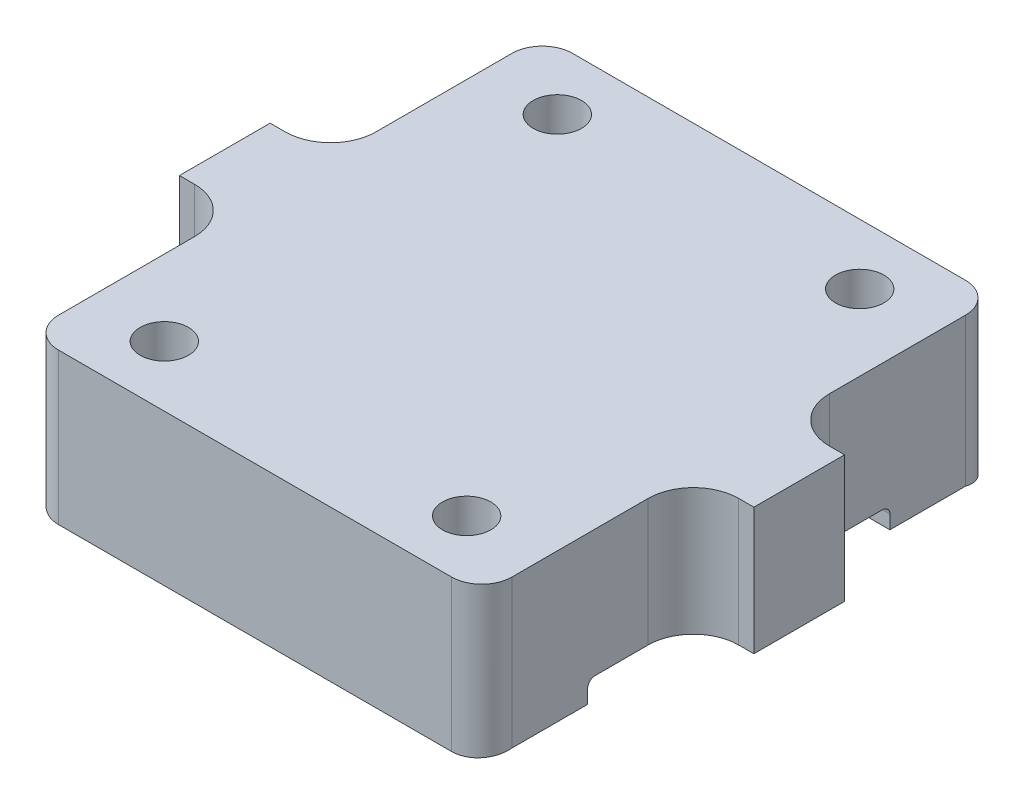
from build123d import *

# Parameters (mm, degrees)
DODANIE_WYCI_GNI_CIE1_DEPTH = 38
SZKIC3_W                    = 4
SZKIC3_H                    = 14
WYTNIJ_WYCI_GNI_CIE1_DEPTH  = 43.884615168
ZAOKR_GLENIE1_R             = 3
SZKIC4_R                    = 1.6
WYTNIJ_WYCI_GNI_CIE2_DEPTH  = 43.884615168
ZAOKR_GLENIE2_R             = 2


with BuildPart() as part:
    # Szkic1 → Dodanie-wyciągnięcie1 (new body)
    with BuildSketch(Plane(origin=(0, 0, 0), x_dir=(0, 0, -1), z_dir=(1, 0, 0))):
        with BuildLine():
            Line((10.000000757, -5.5), (15, -5.5))
            Line((15, -5.5), (17, -6.000001961))
            Line((17, -6.000001961), (17, 4.3))
            Line((17, 4.3), (0, 4.3))
            Line((0, 4.3), (-17.000005226, 4.3))
            Line((-17.000005226, 4.3), (-17.000005226, -5.7))
            Line((-17.000005226, -5.7), (-15.000005226, -5.5))
            Line((-15.000005226, -5.5), (-10.000005983, -5.5))
            Line((-10.000005983, -5.5), (-10.000005983, -4.599994305))
            ThreePointArc((-10.000005983, -4.599994305), (-9.853559374, -4.246440915), (-9.500005983, -4.099994305))
            Line((-9.500005983, -4.099994305), (-9.24e-07, -4.099994305))
            Line((-9.24e-07, -4.099994305), (9.500000757, -4.099994305))
            ThreePointArc((9.500000757, -4.099994305), (9.853554147, -4.246440915), (10.000000757, -4.599994305))
            Line((10.000000757, -4.599994305), (10.000000757, -5.5))
        make_face()
    extrude(amount=DODANIE_WYCI_GNI_CIE1_DEPTH)

    # Szkic3 → Wytnij-wyciągnięcie1 (cut, through all)
    with BuildSketch(Plane(origin=(0, 4.3, 0), x_dir=(1, 0, 0), z_dir=(0, 1, 0))):
        with Locations((2, -10.000005226)):
            Rectangle(SZKIC3_W, SZKIC3_H)
        with Locations((2, 10)):
            Rectangle(SZKIC3_W, SZKIC3_H)
        with Locations((36, -10.000005226)):
            Rectangle(SZKIC3_W, SZKIC3_H)
        with Locations((36, 10)):
            Rectangle(SZKIC3_W, SZKIC3_H)
    extrude(amount=-WYTNIJ_WYCI_GNI_CIE1_DEPTH, mode=Mode.SUBTRACT)

    # Zaokrąglenie1
    zaokr_glenie1_edges = [part.edges().sort_by_distance(p)[0] for p in [
        (34, 0.100002847, -3),
        (34, 0.100002847, 3.000005226),
        (4, 0.100002847, -3),
        (4, 0.100002847, 3.000005226),
    ]]
    fillet(zaokr_glenie1_edges, radius=ZAOKR_GLENIE1_R)

    # Szkic4 → Wytnij-wyciągnięcie2 (cut, through all)
    with BuildSketch(Plane(origin=(0, 4.3, 0), x_dir=(1, 0, 0), z_dir=(0, 1, 0))):
        with Locations((9, 13)):
            Circle(SZKIC4_R)
        with Locations((29, 13)):
            Circle(SZKIC4_R)
        with Locations((9, -13.000005226)):
            Circle(SZKIC4_R)
        with Locations((29, -13.000005226)):
            Circle(SZKIC4_R)
    extrude(amount=-WYTNIJ_WYCI_GNI_CIE2_DEPTH, mode=Mode.SUBTRACT)

    # Zaokrąglenie2
    zaokr_glenie2_edges = [part.edges().sort_by_distance(p)[0] for p in [
        (34, -0.7, 17.000005226),
        (34, -0.85000098, -17),
        (4, -0.85000098, -17),
        (4, -0.7, 17.000005226),
    ]]
    fillet(zaokr_glenie2_edges, radius=ZAOKR_GLENIE2_R)


solid = part.part
